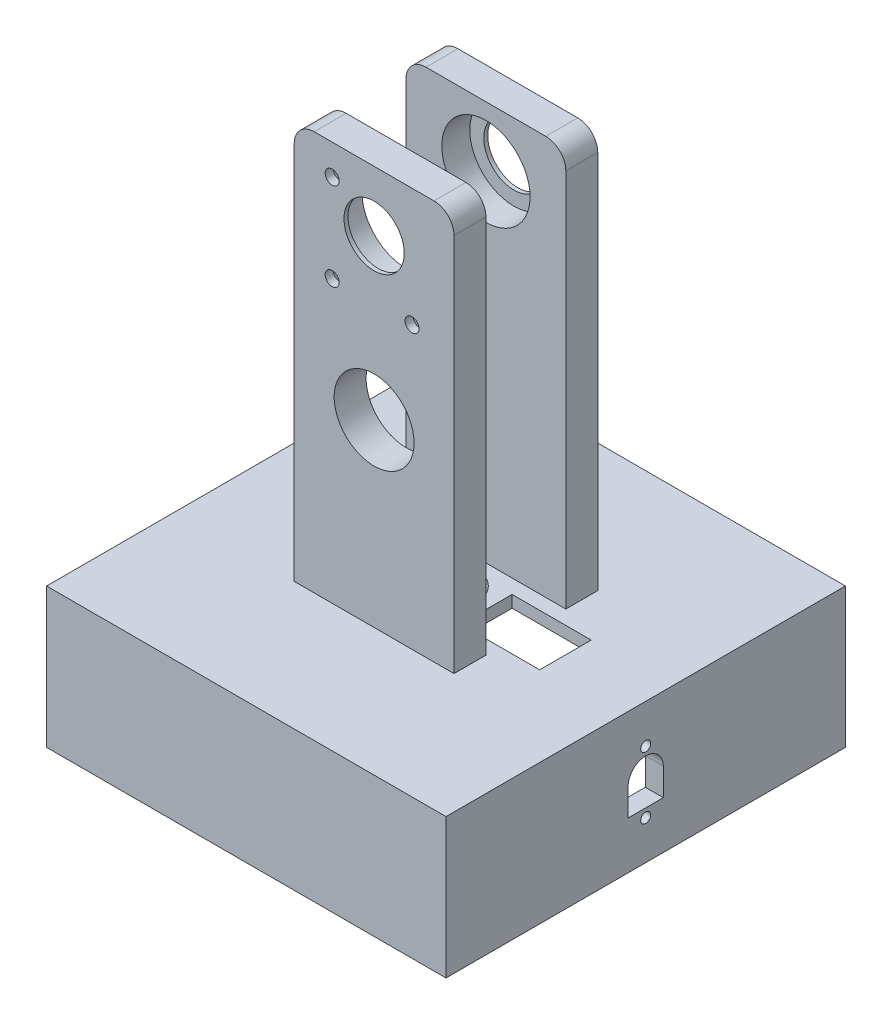
from build123d import *

# Parameters (mm, degrees)
SKETCH1_W            = 100
SKETCH1_H            = 100
BOSS_EXTRUDE1_DEPTH  = 35
SKETCH2_W            = 91
SKETCH2_H            = 91
CUT_EXTRUDE1_DEPTH   = 32
CUT_EXTRUDE3_REACH   = 119.154
SKETCH3_R            = 1.25
CUT_EXTRUDE4_REACH   = 80.899
SKETCH5_W            = 19.8
SKETCH5_H            = 12.9
SKETCH6_W            = 40
SKETCH6_H            = 8
BOSS_EXTRUDE2_DEPTH  = 100
SKETCH7_R            = 11.05
CUT_EXTRUDE5_DEPTH   = 7
CUT_EXTRUDE6_REACH   = 161.214
SKETCH8_R            = 7.55
FILLET1_R            = 5
FILLET1_OF_MIRROR2_R = 5
CUT_EXTRUDE7_REACH   = 124.474
SKETCH9_R            = 7.5
CUT_EXTRUDE10_REACH  = 161.214
SKETCH12_R           = 10
CUT_EXTRUDE11_REACH  = 161.214
SKETCH13_R           = 1.75
CUT_EXTRUDE12_DEPTH  = 6


with BuildPart() as part:
    # Sketch1 → Boss-Extrude1 (new body)
    with BuildSketch(Plane(origin=(0, 0, 0), x_dir=(1, 0, 0), z_dir=(0, 1, 0))):
        Rectangle(SKETCH1_W, SKETCH1_H)
    extrude(amount=BOSS_EXTRUDE1_DEPTH)

    # Sketch2 → Cut-Extrude1 (cut)
    with BuildSketch(Plane.XZ):
        Rectangle(SKETCH2_W, SKETCH2_H)
    extrude(amount=-CUT_EXTRUDE1_DEPTH, mode=Mode.SUBTRACT)

    # Sketch3 → Cut-Extrude3 (cut, up to next)
    with BuildSketch(Plane(origin=(50, 0, 0), x_dir=(0, 0, -1), z_dir=(1, 0, 0)), mode=Mode.PRIVATE) as cut_extrude3_sk1:
        with Locations((0, 25.25)):
            Circle(SKETCH3_R)
    cut_extrude3_tool1 = extrude(cut_extrude3_sk1.sketch, amount=-CUT_EXTRUDE3_REACH, mode=Mode.PRIVATE) & part.part
    # Sketch3 → Cut-Extrude3 (cut, up to next)
    with BuildSketch(Plane(origin=(50, 0, 0), x_dir=(0, 0, -1), z_dir=(1, 0, 0)), mode=Mode.PRIVATE) as cut_extrude3_sk2:
        with Locations((0, 9.75)):
            Circle(SKETCH3_R)
    cut_extrude3_tool2 = extrude(cut_extrude3_sk2.sketch, amount=-CUT_EXTRUDE3_REACH, mode=Mode.PRIVATE) & part.part
    # Sketch3 → Cut-Extrude3 (cut, up to next)
    with BuildSketch(Plane(origin=(50, 0, 0), x_dir=(0, 0, -1), z_dir=(1, 0, 0)), mode=Mode.PRIVATE) as cut_extrude3_sk3:
        with BuildLine():
            Line((-4.4, 11.9), (4.4, 11.9))
            Line((4.4, 11.9), (4.4, 18.75))
            ThreePointArc((4.4, 18.75), (0, 23.15), (-4.4, 18.75))
            Line((-4.4, 18.75), (-4.4, 11.9))
        make_face()
    cut_extrude3_tool3 = extrude(cut_extrude3_sk3.sketch, amount=-CUT_EXTRUDE3_REACH, mode=Mode.PRIVATE) & part.part
    add(cut_extrude3_tool1.solids().sort_by_distance((50, 25.25, 0))[0], mode=Mode.SUBTRACT)
    add(cut_extrude3_tool2.solids().sort_by_distance((50, 9.75, 0))[0], mode=Mode.SUBTRACT)
    add(cut_extrude3_tool3.solids().sort_by_distance((50, 17.099668, 0))[0], mode=Mode.SUBTRACT)

    # Sketch5 → Cut-Extrude4 (cut, up to next)
    with BuildSketch(Plane(origin=(0, 35, 0), x_dir=(1, 0, 0), z_dir=(0, 1, 0)), mode=Mode.PRIVATE) as cut_extrude4_sk1:
        with Locations((20, 0)):
            Rectangle(SKETCH5_W, SKETCH5_H)
    cut_extrude4_tool1 = extrude(cut_extrude4_sk1.sketch, amount=-CUT_EXTRUDE4_REACH, mode=Mode.PRIVATE) & part.part
    add(cut_extrude4_tool1.solids().sort_by_distance((20, 35, 0))[0], mode=Mode.SUBTRACT)

    # Sketch6 → Boss-Extrude2 (add)
    with BuildSketch(Plane(origin=(0, 35, 0), x_dir=(1, 0, 0), z_dir=(0, 1, 0))):
        with Locations((0, -14)):
            Rectangle(SKETCH6_W, SKETCH6_H)
    boss_extrude2 = extrude(amount=BOSS_EXTRUDE2_DEPTH)

    # Sketch7 → Cut-Extrude5 (cut)
    with BuildSketch(Plane(origin=(0, 0, 10), x_dir=(-1, 0, 0), z_dir=(0, 0, -1))):
        with Locations((0, 119.9)):
            Circle(SKETCH7_R)
    cut_extrude5 = extrude(amount=-CUT_EXTRUDE5_DEPTH, mode=Mode.SUBTRACT)

    # Sketch8 → Cut-Extrude6 (cut, up to next)
    with BuildSketch(Plane.XY.offset(18), mode=Mode.PRIVATE) as cut_extrude6_sk1:
        with Locations((0, 119.9)):
            Circle(SKETCH8_R)
    cut_extrude6_tool1 = extrude(cut_extrude6_sk1.sketch, amount=-CUT_EXTRUDE6_REACH, mode=Mode.PRIVATE) & part.part
    cut_extrude6 = cut_extrude6_tool1.solids().sort_by_distance((0, 119.9, 18))[0]
    add(cut_extrude6, mode=Mode.SUBTRACT)

    # Fillet1
    fillet1_edges = [part.edges().sort_by_distance(p)[0] for p in [
        (-20, 135, 14),
        (20, 135, 14),
    ]]
    fillet(fillet1_edges, radius=FILLET1_R)

    # Mirror2: Boss-Extrude2, Cut-Extrude5, Cut-Extrude6 across plane
    add(boss_extrude2.mirror(Plane.XY))
    add(cut_extrude5.mirror(Plane.XY), mode=Mode.SUBTRACT)
    add(cut_extrude6.mirror(Plane.XY), mode=Mode.SUBTRACT)

    # Fillet1 of Mirror2
    fillet1_of_mirror2_edges = [part.edges().sort_by_distance(p)[0] for p in [
        (-20, 135, -14),
        (20, 135, -14),
    ]]
    fillet(fillet1_of_mirror2_edges, radius=FILLET1_OF_MIRROR2_R)

    # Sketch9 → Cut-Extrude7 (cut, up to next)
    with BuildSketch(Plane(origin=(0, 35, 0), x_dir=(1, 0, 0), z_dir=(0, 1, 0)), mode=Mode.PRIVATE) as cut_extrude7_sk1:
        Circle(SKETCH9_R)
    cut_extrude7_tool1 = extrude(cut_extrude7_sk1.sketch, amount=-CUT_EXTRUDE7_REACH, mode=Mode.PRIVATE) & part.part
    add(cut_extrude7_tool1.solids().sort_by_distance((0, 35, 0))[0], mode=Mode.SUBTRACT)

    # Sketch12 → Cut-Extrude10 (cut, up to next)
    with BuildSketch(Plane.XY.offset(18), mode=Mode.PRIVATE) as cut_extrude10_sk1:
        with Locations((0, 80)):
            Circle(SKETCH12_R)
    cut_extrude10_tool1 = extrude(cut_extrude10_sk1.sketch, amount=-CUT_EXTRUDE10_REACH, mode=Mode.PRIVATE) & part.part
    add(cut_extrude10_tool1.solids().sort_by_distance((0, 80, 18))[0], mode=Mode.SUBTRACT)

    # Sketch13 → Cut-Extrude11 (cut, up to next)
    with BuildSketch(Plane.XY.offset(18), mode=Mode.PRIVATE) as cut_extrude11_sk1:
        with Locations((-10.5, 105.4)):
            Circle(SKETCH13_R)
    cut_extrude11_tool1 = extrude(cut_extrude11_sk1.sketch, amount=-CUT_EXTRUDE11_REACH, mode=Mode.PRIVATE) & part.part
    # Sketch13 → Cut-Extrude11 (cut, up to next)
    with BuildSketch(Plane.XY.offset(18), mode=Mode.PRIVATE) as cut_extrude11_sk2:
        with Locations((-10.5, 127.4)):
            Circle(SKETCH13_R)
    cut_extrude11_tool2 = extrude(cut_extrude11_sk2.sketch, amount=-CUT_EXTRUDE11_REACH, mode=Mode.PRIVATE) & part.part
    # Sketch13 → Cut-Extrude11 (cut, up to next)
    with BuildSketch(Plane.XY.offset(18), mode=Mode.PRIVATE) as cut_extrude11_sk3:
        with Locations((9.5, 105.4)):
            Circle(SKETCH13_R)
    cut_extrude11_tool3 = extrude(cut_extrude11_sk3.sketch, amount=-CUT_EXTRUDE11_REACH, mode=Mode.PRIVATE) & part.part
    add(cut_extrude11_tool1.solids().sort_by_distance((-10.5, 105.4, 18))[0], mode=Mode.SUBTRACT)
    add(cut_extrude11_tool2.solids().sort_by_distance((-10.5, 127.4, 18))[0], mode=Mode.SUBTRACT)
    add(cut_extrude11_tool3.solids().sort_by_distance((9.5, 105.4, 18))[0], mode=Mode.SUBTRACT)

    # Sketch14 → Cut-Extrude12 (cut)
    with BuildSketch(Plane(origin=(0, 0, 10), x_dir=(-1, 0, 0), z_dir=(0, 0, -1))):
        Polygon((-11.174315781, 108.3), (-7.825684219, 108.3), (-6.151368439, 105.4), (-7.825684219, 102.5), (-11.174315781, 102.5), (-12.848631561, 105.4), align=None)
        Polygon((13.848631561, 105.4), (12.174315781, 108.3), (8.825684219, 108.3), (7.151368439, 105.4), (8.825684219, 102.5), (12.174315781, 102.5), align=None)
        Polygon((7.151368439, 127.4), (8.825684219, 130.3), (12.174315781, 130.3), (13.848631561, 127.4), (12.174315781, 124.5), (8.825684219, 124.5), align=None)
    extrude(amount=-CUT_EXTRUDE12_DEPTH, mode=Mode.SUBTRACT)


solid = part.part
